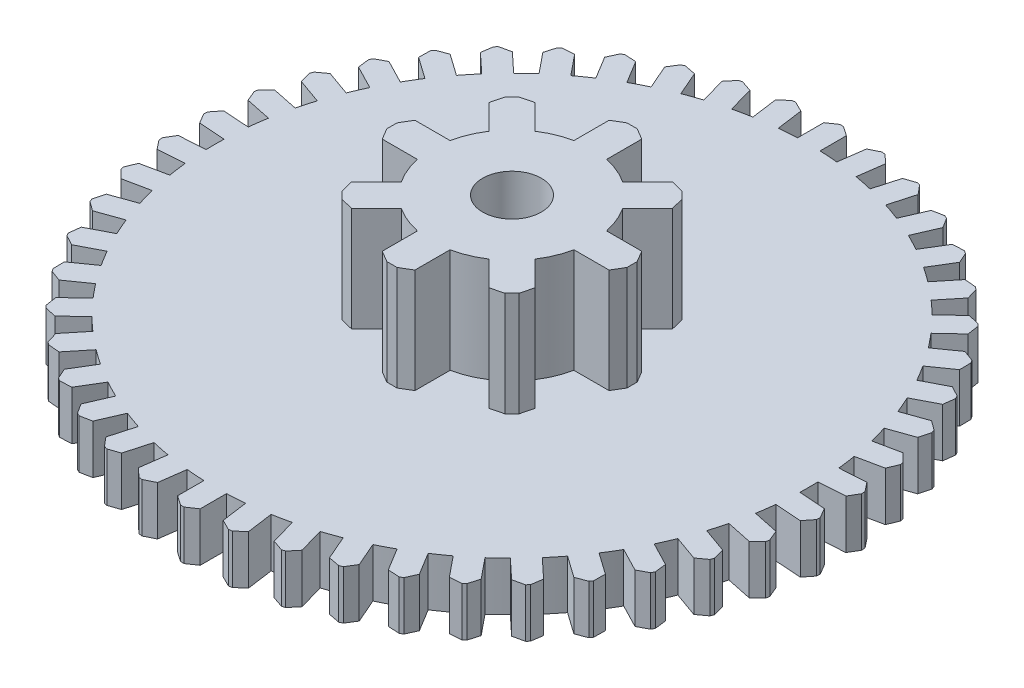
from build123d import *

# Parameters (mm, degrees)
SKETCH1_R           = 9.1
BOSS_EXTRUDE1_DEPTH = 1.5
SKETCH2_R           = 2.45
BOSS_EXTRUDE2_DEPTH = 3.2
SKETCH3_R           = 0.9
CUT_EXTRUDE1_DEPTH  = 14.700729908
BOSS_EXTRUDE3_DEPTH = 1.5
CIRPATTERN1_COUNT   = 46
BOSS_EXTRUDE4_DEPTH = 3.5
CIRPATTERN2_COUNT   = 8


with BuildPart() as part:
    # Sketch1 → Boss-Extrude1 (new body)
    with BuildSketch(Plane(origin=(0, 0, 0), x_dir=(1, 0, 0), z_dir=(0, 1, 0))):
        Circle(SKETCH1_R)
    extrude(amount=BOSS_EXTRUDE1_DEPTH)

    # Sketch2 → Boss-Extrude2 (add)
    with BuildSketch(Plane(origin=(0, 1.5, 0), x_dir=(1, 0, 0), z_dir=(0, 1, 0))):
        Circle(SKETCH2_R)
    extrude(amount=BOSS_EXTRUDE2_DEPTH)

    # Sketch3 → Cut-Extrude1 (cut, through all)
    with BuildSketch(Plane(origin=(0, 4.7, 0), x_dir=(1, 0, 0), z_dir=(0, 1, 0))):
        Circle(SKETCH3_R)
    extrude(amount=-CUT_EXTRUDE1_DEPTH, mode=Mode.SUBTRACT)

    # Sketch6 → Boss-Extrude3 (add)
    with BuildSketch(Plane(origin=(0, 1.5, 0), x_dir=(1, 0, 0), z_dir=(0, 1, 0))):
        Polygon((0.346175928, 9.054986556), (-0.346175928, 9.054986556), (-0.346175928, 9.900000132), (-0.053720269, 10.100570395), (0.053720269, 10.100570395), (0.346175928, 9.900000132), align=None)
    boss_extrude3 = extrude(amount=-BOSS_EXTRUDE3_DEPTH)

    # CirPattern1: Boss-Extrude3 ×46 about axis
    cirpattern1_axis = Axis((0, 1.5, 0), (0, 1, 0))
    for i in range(1, CIRPATTERN1_COUNT):
        add(boss_extrude3.rotate(cirpattern1_axis, i * 360 / CIRPATTERN1_COUNT))

    # Sketch7 → Boss-Extrude4 (add)
    with BuildSketch(Plane(origin=(0, 4.7, 0), x_dir=(1, 0, 0), z_dir=(0, 1, 0))):
        Polygon((-0.156740287, 3.679140092), (-0.5, 3.475218084), (-0.5, 2.313631969), (0.5, 2.313631969), (0.5, 3.475218084), (0.156740287, 3.679140092), align=None)
    boss_extrude4 = extrude(amount=-BOSS_EXTRUDE4_DEPTH)

    # CirPattern2: Boss-Extrude4 ×8 about axis
    cirpattern2_axis = Axis((0, 4.7, 0), (0, 1, 0))
    for i in range(1, CIRPATTERN2_COUNT):
        add(boss_extrude4.rotate(cirpattern2_axis, i * 360 / CIRPATTERN2_COUNT))


solid = part.part
